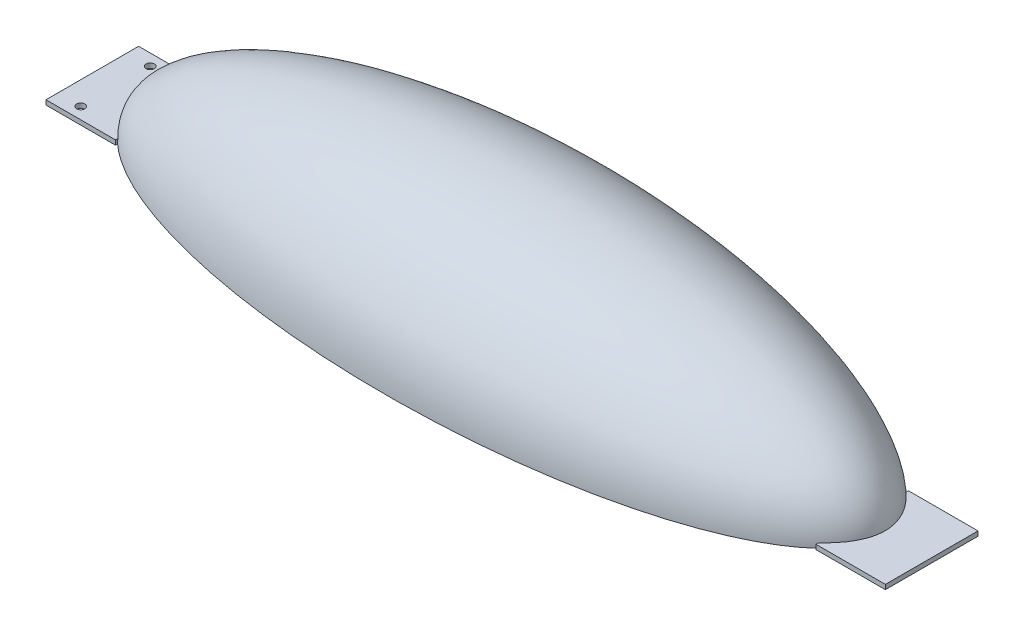
from build123d import *

# Parameters (mm, degrees)
SKETCH2_W           = 422.5
SKETCH2_H           = 160
CUT_EXTRUDE1_DEPTH  = 80
SKETCH3_W           = 30
SKETCH3_H           = 40
BOSS_EXTRUDE1_DEPTH = 2
SKETCH4_R           = 1.8
CUT_EXTRUDE2_DEPTH  = 3


with BuildPart() as part:
    # Sketch1 → Revolve1 (revolve)
    with BuildSketch(Plane.XY):
        with BuildLine():
            Line((-322.5, 0), (0, 0))
            add(Edge.make_bspline(
                [(0, 0), (0, 55), (-161.25, 55), (-322.5, 55), (-322.5, 0)],
                knots=[0, 0, 0, 1.570796327, 1.570796327, 3.141592654, 3.141592654, 3.141592654], degree=2, weights=[1, 0.707106781, 1, 0.707106781, 1]))
        make_face()
    revolve(axis=Axis((10, 0, 0), (-1, 0, 0)))

    # Sketch2 → Cut-Extrude1 (cut)
    with BuildSketch(Plane(origin=(0, 0, 0), x_dir=(1, 0, 0), z_dir=(0, 1, 0))):
        with Locations((-161.25, 0)):
            Rectangle(SKETCH2_W, SKETCH2_H)
    extrude(amount=-CUT_EXTRUDE1_DEPTH, mode=Mode.SUBTRACT)

    # Sketch3 → Boss-Extrude1 (add)
    with BuildSketch(Plane(origin=(0, 0, 0), x_dir=(1, 0, 0), z_dir=(0, 1, 0))):
        with Locations((-327.5, 0)):
            Rectangle(SKETCH3_W, SKETCH3_H)
        with Locations((5, 0)):
            Rectangle(SKETCH3_W, SKETCH3_H)
    extrude(amount=BOSS_EXTRUDE1_DEPTH)

    # Sketch4 → Cut-Extrude2 (cut)
    with BuildSketch(Plane(origin=(0, 0, 0), x_dir=(1, 0, 0), z_dir=(0, 1, 0))):
        with Locations((-332.5, -15)):
            Circle(SKETCH4_R)
        with Locations((-332.5, 15)):
            Circle(SKETCH4_R)
    extrude(amount=CUT_EXTRUDE2_DEPTH, mode=Mode.SUBTRACT)


solid = part.part
